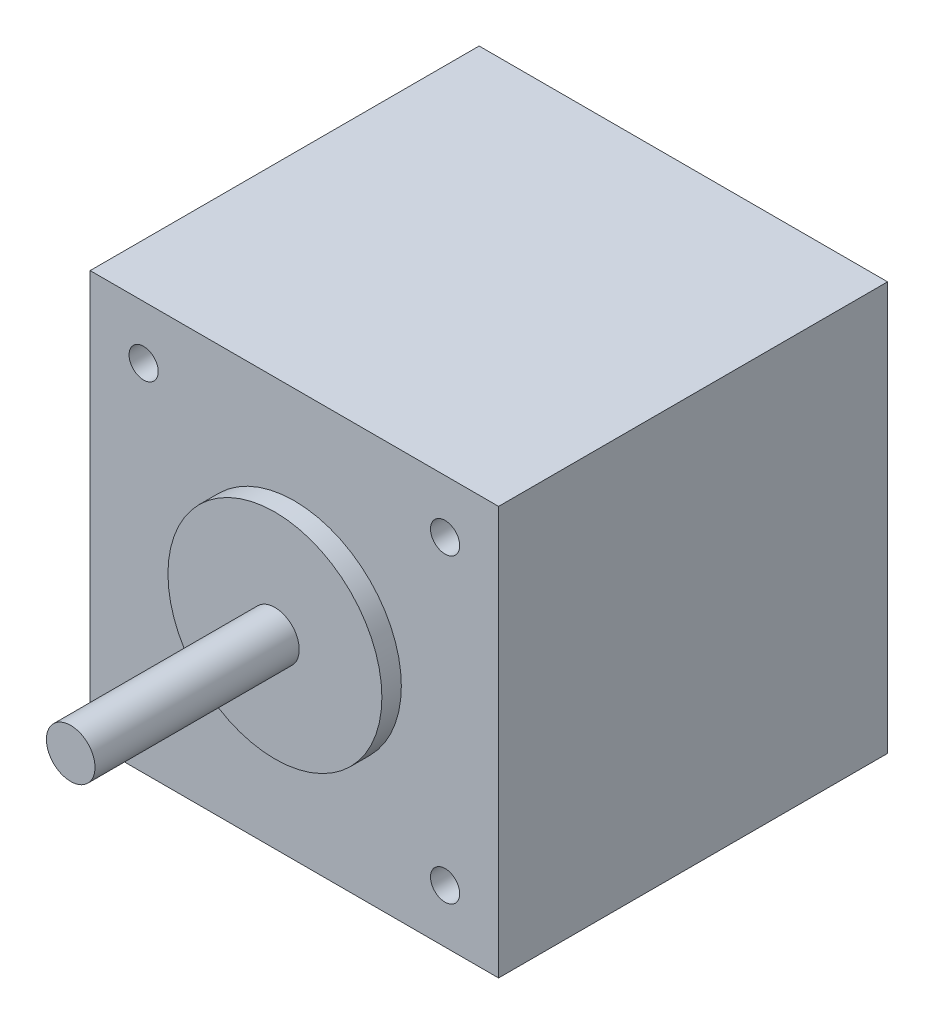
from build123d import *

# Parameters (mm, degrees)
SKETCH_1_W          = 42
SKETCH_1_H          = 42
EXTRUDE_1577_DEPTH  = 40
SKETCH_2_R          = 2.5
EXTRUDE_1632_DEPTH  = 63
SKETCH_3_R          = 11
EXTRUDE_1679_DEPTH  = 42
CUT_EXTRUDE_START   = 40
SKETCH_4_R          = 1.5
CUT_EXTRUDE_3_DEPTH = 4.5


with BuildPart() as part:
    # Эскиз1 → Extrude 1577 (new body)
    with BuildSketch(Plane.XY):
        Rectangle(SKETCH_1_W, SKETCH_1_H)
    extrude(amount=EXTRUDE_1577_DEPTH)

    # Эскиз2 → Extrude 1632 (add)
    with BuildSketch(Plane.XY):
        Circle(SKETCH_2_R)
    extrude(amount=EXTRUDE_1632_DEPTH)

    # Эскиз3 → Extrude 1679 (add)
    with BuildSketch(Plane.XY):
        Circle(SKETCH_3_R)
    extrude(amount=EXTRUDE_1679_DEPTH)

    # Эскиз4 → Крепеж_М3_ПРЕДВ (cut)
    with BuildSketch(Plane.XY.offset(CUT_EXTRUDE_START)):
        with Locations((-15.5, -15.5)):
            Circle(SKETCH_4_R)
        with Locations((-15.5, 15.5)):
            Circle(SKETCH_4_R)
        with Locations((15.5, -15.5)):
            Circle(SKETCH_4_R)
        with Locations((15.5, 15.5)):
            Circle(SKETCH_4_R)
    extrude(amount=-CUT_EXTRUDE_3_DEPTH, mode=Mode.SUBTRACT)


solid = part.part
